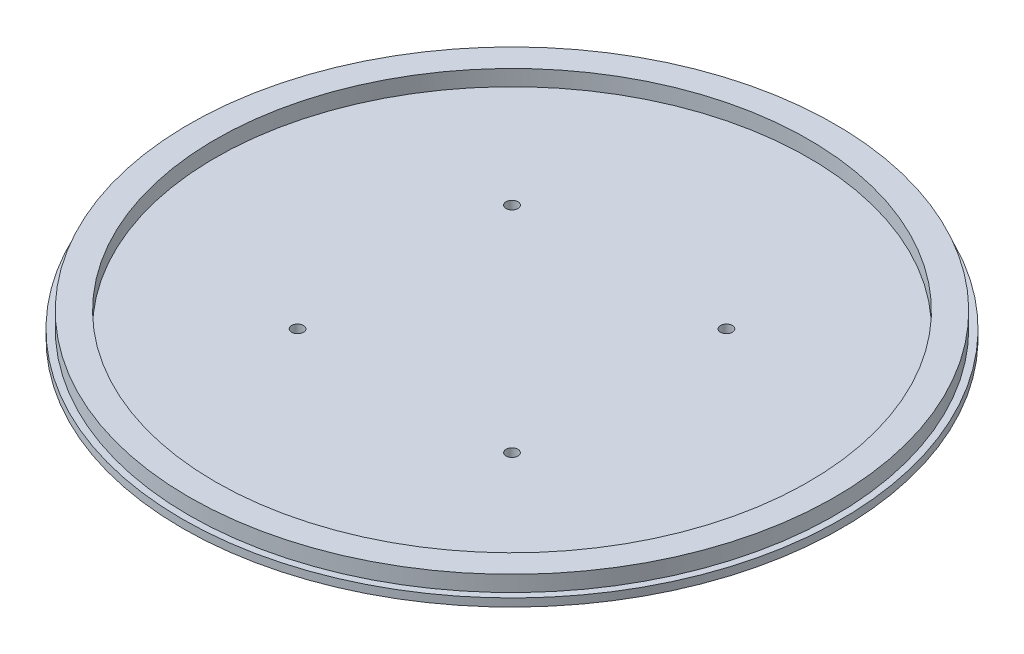
from build123d import *

# Parameters (mm, degrees)
SKETCH1_R            = 125
BOSS_EXTRUDE1_DEPTH  = 3
SKETCH2_R            = 122.5
SKETCH2_R_2          = 112.5
BOSS_EXTRUDE2_DEPTH  = 6
SKETCH3_W            = 94.5
SKETCH3_H            = 94.5
BOSS_EXTRUDE3_DEPTH  = 8
M4_CLEARANCE_HOLE1_D = 4.5
FILLET1_R            = 3
SKETCH8_W            = 21
SKETCH8_H            = 21
BOSS_EXTRUDE4_DEPTH  = 5
FILLET2_R            = 6
FILLET3_R            = 23


with BuildPart() as part:
    # Sketch1 → Boss-Extrude1 (new body)
    with BuildSketch(Plane(origin=(0, 0, 0), x_dir=(1, 0, 0), z_dir=(0, 1, 0))):
        with Locations(Location((0, 0, 0), (0, 0, 270))):
            Circle(SKETCH1_R)
    extrude(amount=BOSS_EXTRUDE1_DEPTH)

    # Sketch2 → Boss-Extrude2 (add)
    with BuildSketch(Plane(origin=(0, 3, 0), x_dir=(1, 0, 0), z_dir=(0, 1, 0))):
        with Locations(Location((0, 0, 0), (0, 0, 270))):
            Circle(SKETCH2_R)
        with Locations(Location((0, 0, 0), (0, 0, 270))):
            Circle(SKETCH2_R_2, mode=Mode.SUBTRACT)
    extrude(amount=BOSS_EXTRUDE2_DEPTH)

    # Sketch3 → Boss-Extrude3 (add)
    with BuildSketch(Plane.XZ):
        Rectangle(SKETCH3_W, SKETCH3_H)
    extrude(amount=BOSS_EXTRUDE3_DEPTH)

    # M4 Clearance Hole1 (through all)
    with Locations(Plane(origin=(0, -8, 0), x_dir=(-1, 0, 0), z_dir=(0, -1, 0))):
        with Locations((40.66, 40.66), (40.66, -40.66), (-40.66, -40.66), (-40.66, 40.66)):
            Hole(M4_CLEARANCE_HOLE1_D / 2)

    # Fillet1
    fillet1_edges = [part.edges().sort_by_distance(p)[0] for p in [
        (0, 0, -47.25),
        (-47.25, 0, 0),
        (0, 0, 47.25),
        (47.25, 0, 0),
    ]]
    fillet(fillet1_edges, radius=FILLET1_R)

    # Sketch8 → Boss-Extrude4 (add)
    with BuildSketch(Plane(origin=(0, 0, 0), x_dir=(-1, 0, 0), z_dir=(0, -1, 0))):
        with Locations((75.1, 0)):
            Rectangle(SKETCH8_W, SKETCH8_H)
    extrude(amount=BOSS_EXTRUDE4_DEPTH)

    # Fillet2
    # the kernel refuses this fillet: 6 mm, written as the material it adds along each edge
    with BuildSketch(Plane(origin=(-64.6, 0, 10.5), x_dir=(1, 0, 0), z_dir=(0, 0, -1)), Plane(origin=(-85.6, 0, 10.5), x_dir=(0, 0, 1), z_dir=(1, 0, 0)), Plane(origin=(-85.6, 0, -10.5), x_dir=(-1, 0, 0), z_dir=(0, 0, 1)), Plane(origin=(-64.6, 0, -10.5), x_dir=(0, 0, -1), z_dir=(-1, 0, 0))) as fillet2_piece_1:
        with BuildLine():
            CenterArc((5.916079783, 6), FILLET2_R, 189.594068227, 80.405931773)
            Line((0, 5), (-0.118321596, 4.98))
            ThreePointArc((-0.118321596, 4.98), (-0.12, 2.5), (-0.12, 0))
            Line((-0.12, 0), (0, -0.12))
            Line((0, -0.12), (5.916079783, -0.12))
            Line((5.916079783, -0.12), (5.916079783, 0))
        make_face()
    extrude(amount=21)
    with BuildSketch(Plane(origin=(-85.6, 0, 10.5), x_dir=(0, 0, 1), z_dir=(1, 0, 0))) as fillet2_piece_2a_section:
        with BuildLine():
            CenterArc((5.916079783, 6), FILLET2_R, 189.594068227, 80.405931773)
            Line((0, 5), (-0.118321596, 4.98))
            ThreePointArc((-0.118321596, 4.98), (-0.12, 2.5), (-0.12, 0))
            Line((-0.12, 0), (0, -0.12))
            Line((0, -0.12), (5.916079783, -0.12))
            Line((5.916079783, -0.12), (5.916079783, 0))
        make_face()
    fillet2_piece_2a = extrude(amount=35.790199458, mode=Mode.PRIVATE)
    fillet2_piece_2a = split(fillet2_piece_2a, bisect_by=Plane(origin=(-64.6, -1.233917871, 11.87196406), z_dir=(1, 0, 0)), keep=Keep.TOP, mode=Mode.PRIVATE)
    with BuildSketch(Plane(origin=(-64.6, 0, 25.290199458), x_dir=(1, 0, 0), z_dir=(0, 0, -1))) as fillet2_piece_2b_section:
        with BuildLine():
            CenterArc((5.916079783, 6), FILLET2_R, 189.594068227, 80.405931773)
            Line((0, 5), (-0.118321596, 4.98))
            ThreePointArc((-0.118321596, 4.98), (-0.12, 2.5), (-0.12, 0))
            Line((-0.12, 0), (0, -0.12))
            Line((0, -0.12), (5.916079783, -0.12))
            Line((5.916079783, -0.12), (5.916079783, 0))
        make_face()
    fillet2_piece_2b = extrude(amount=35.790199458, mode=Mode.PRIVATE)
    fillet2_piece_2b = split(fillet2_piece_2b, bisect_by=Plane(origin=(-63.22803594, -1.233917871, 10.5), z_dir=(0, 0, 1)), keep=Keep.TOP, mode=Mode.PRIVATE)
    fillet2_piece_2 = fillet2_piece_2a & fillet2_piece_2b
    add(fillet2_piece_2)
    with BuildSketch(Plane(origin=(-64.6, 0, 10.5), x_dir=(1, 0, 0), z_dir=(0, 0, -1))) as fillet2_piece_3a_section:
        with BuildLine():
            CenterArc((5.916079783, 6), FILLET2_R, 189.594068227, 80.405931773)
            Line((0, 5), (-0.118321596, 4.98))
            ThreePointArc((-0.118321596, 4.98), (-0.12, 2.5), (-0.12, 0))
            Line((-0.12, 0), (0, -0.12))
            Line((0, -0.12), (5.916079783, -0.12))
            Line((5.916079783, -0.12), (5.916079783, 0))
        make_face()
    fillet2_piece_3a = extrude(amount=35.790199458, mode=Mode.PRIVATE)
    fillet2_piece_3a = split(fillet2_piece_3a, bisect_by=Plane(origin=(-63.22803594, -1.233917871, -10.5), z_dir=(0, 0, -1)), keep=Keep.TOP, mode=Mode.PRIVATE)
    with BuildSketch(Plane(origin=(-49.809800542, 0, -10.5), x_dir=(0, 0, -1), z_dir=(-1, 0, 0))) as fillet2_piece_3b_section:
        with BuildLine():
            CenterArc((5.916079783, 6), FILLET2_R, 189.594068227, 80.405931773)
            Line((0, 5), (-0.118321596, 4.98))
            ThreePointArc((-0.118321596, 4.98), (-0.12, 2.5), (-0.12, 0))
            Line((-0.12, 0), (0, -0.12))
            Line((0, -0.12), (5.916079783, -0.12))
            Line((5.916079783, -0.12), (5.916079783, 0))
        make_face()
    fillet2_piece_3b = extrude(amount=35.790199458, mode=Mode.PRIVATE)
    fillet2_piece_3b = split(fillet2_piece_3b, bisect_by=Plane(origin=(-64.6, -1.233917871, -11.87196406), z_dir=(1, 0, 0)), keep=Keep.TOP, mode=Mode.PRIVATE)
    fillet2_piece_3 = fillet2_piece_3a & fillet2_piece_3b
    add(fillet2_piece_3)
    with BuildSketch(Plane(origin=(-100.390199458, 0, 10.5), x_dir=(0, 0, 1), z_dir=(1, 0, 0))) as fillet2_piece_4a_section:
        with BuildLine():
            CenterArc((5.916079783, 6), FILLET2_R, 189.594068227, 80.405931773)
            Line((0, 5), (-0.118321596, 4.98))
            ThreePointArc((-0.118321596, 4.98), (-0.12, 2.5), (-0.12, 0))
            Line((-0.12, 0), (0, -0.12))
            Line((0, -0.12), (5.916079783, -0.12))
            Line((5.916079783, -0.12), (5.916079783, 0))
        make_face()
    fillet2_piece_4a = extrude(amount=35.790199458, mode=Mode.PRIVATE)
    fillet2_piece_4a = split(fillet2_piece_4a, bisect_by=Plane(origin=(-85.6, -1.233917871, 11.87196406), z_dir=(-1, 0, 0)), keep=Keep.TOP, mode=Mode.PRIVATE)
    with BuildSketch(Plane(origin=(-85.6, 0, -10.5), x_dir=(-1, 0, 0), z_dir=(0, 0, 1))) as fillet2_piece_4b_section:
        with BuildLine():
            CenterArc((5.916079783, 6), FILLET2_R, 189.594068227, 80.405931773)
            Line((0, 5), (-0.118321596, 4.98))
            ThreePointArc((-0.118321596, 4.98), (-0.12, 2.5), (-0.12, 0))
            Line((-0.12, 0), (0, -0.12))
            Line((0, -0.12), (5.916079783, -0.12))
            Line((5.916079783, -0.12), (5.916079783, 0))
        make_face()
    fillet2_piece_4b = extrude(amount=35.790199458, mode=Mode.PRIVATE)
    fillet2_piece_4b = split(fillet2_piece_4b, bisect_by=Plane(origin=(-86.97196406, -1.233917871, 10.5), z_dir=(0, 0, 1)), keep=Keep.TOP, mode=Mode.PRIVATE)
    fillet2_piece_4 = fillet2_piece_4a & fillet2_piece_4b
    add(fillet2_piece_4)
    with BuildSketch(Plane(origin=(-64.6, 0, -10.5), x_dir=(0, 0, -1), z_dir=(-1, 0, 0))) as fillet2_piece_5a_section:
        with BuildLine():
            CenterArc((5.916079783, 6), FILLET2_R, 189.594068227, 80.405931773)
            Line((0, 5), (-0.118321596, 4.98))
            ThreePointArc((-0.118321596, 4.98), (-0.12, 2.5), (-0.12, 0))
            Line((-0.12, 0), (0, -0.12))
            Line((0, -0.12), (5.916079783, -0.12))
            Line((5.916079783, -0.12), (5.916079783, 0))
        make_face()
    fillet2_piece_5a = extrude(amount=35.790199458, mode=Mode.PRIVATE)
    fillet2_piece_5a = split(fillet2_piece_5a, bisect_by=Plane(origin=(-85.6, -1.233917871, -11.87196406), z_dir=(-1, 0, 0)), keep=Keep.TOP, mode=Mode.PRIVATE)
    with BuildSketch(Plane(origin=(-85.6, 0, -25.290199458), x_dir=(-1, 0, 0), z_dir=(0, 0, 1))) as fillet2_piece_5b_section:
        with BuildLine():
            CenterArc((5.916079783, 6), FILLET2_R, 189.594068227, 80.405931773)
            Line((0, 5), (-0.118321596, 4.98))
            ThreePointArc((-0.118321596, 4.98), (-0.12, 2.5), (-0.12, 0))
            Line((-0.12, 0), (0, -0.12))
            Line((0, -0.12), (5.916079783, -0.12))
            Line((5.916079783, -0.12), (5.916079783, 0))
        make_face()
    fillet2_piece_5b = extrude(amount=35.790199458, mode=Mode.PRIVATE)
    fillet2_piece_5b = split(fillet2_piece_5b, bisect_by=Plane(origin=(-86.97196406, -1.233917871, -10.5), z_dir=(0, 0, -1)), keep=Keep.TOP, mode=Mode.PRIVATE)
    fillet2_piece_5 = fillet2_piece_5a & fillet2_piece_5b
    add(fillet2_piece_5)

    # Fillet3
    fillet3_edges = [part.edges().sort_by_distance(p)[0] for p in [
        (-85.6, -5, 0),
        (-75.1, -5, -10.5),
        (-64.6, -5, 0),
        (-75.1, -5, 10.5),
    ]]
    fillet(fillet3_edges, radius=FILLET3_R)


solid = part.part
